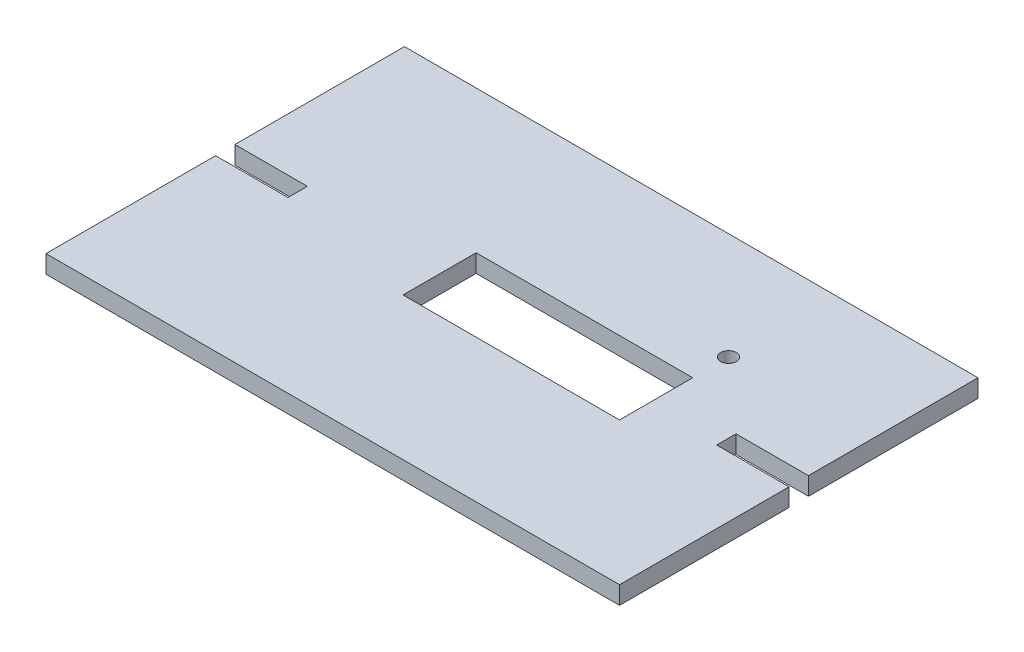
from build123d import *

# Parameters (mm, degrees)
SKETCH1_R           = 2.778125
SKETCH1_W           = 76.708
SKETCH1_H           = 25.908
BOSS_EXTRUDE1_DEPTH = 6.35


with BuildPart() as part:
    # Sketch1 → Boss-Extrude1 (new body)
    with BuildSketch(Plane(origin=(0, 0, 0), x_dir=(1, 0, 0), z_dir=(0, 1, 0))):
        Polygon((0, 0), (203.2, 0), (203.2, 60.071), (177.546, 60.071), (177.546, 66.929), (203.2, 66.929), (203.2, 127), (0, 127), (0, 66.929), (25.654, 66.929), (25.654, 60.071), (0, 60.071), align=None)
        with Locations((152.654, 89.154)):
            Circle(SKETCH1_R, mode=Mode.SUBTRACT)
        with Locations((114.3, 63.5)):
            Rectangle(SKETCH1_W, SKETCH1_H, mode=Mode.SUBTRACT)
    extrude(amount=BOSS_EXTRUDE1_DEPTH)


solid = part.part
